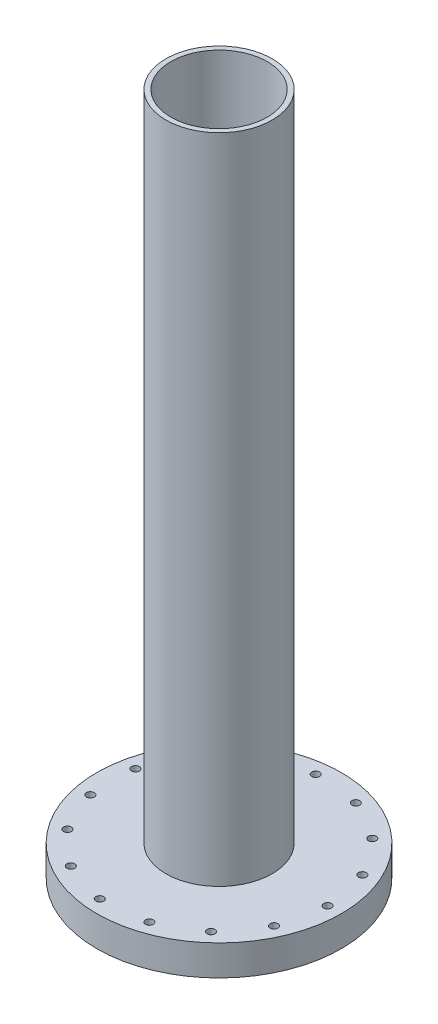
from build123d import *

# Parameters (mm, degrees)
SKETCH1_R                        = 35
SKETCH1_R_2                      = 31.75
BOSS_EXTRUDE1_DEPTH              = 450
SKETCH2_R                        = 80.54
SKETCH2_R_2                      = 31.75
BOSS_EXTRUDE2_DEPTH              = 20
F_13_64_0_20313_DIAMETER_HOLE1_D = 5.159502
CIRPATTERN1_COUNT                = 15


with BuildPart() as part:
    # Sketch1 → Boss-Extrude1 (new body)
    with BuildSketch(Plane(origin=(0, 0, 0), x_dir=(1, 0, 0), z_dir=(0, 1, 0))):
        Circle(SKETCH1_R)
        Circle(SKETCH1_R_2, mode=Mode.SUBTRACT)
    extrude(amount=BOSS_EXTRUDE1_DEPTH)

    # Sketch2 → Boss-Extrude2 (add)
    with BuildSketch(Plane(origin=(0, 0, 0), x_dir=(1, 0, 0), z_dir=(0, 1, 0))):
        Circle(SKETCH2_R)
        Circle(SKETCH2_R_2, mode=Mode.SUBTRACT)
    extrude(amount=BOSS_EXTRUDE2_DEPTH)

    # 13/64 (0.20313) Diameter Hole1 (through all)
    with Locations(Plane(origin=(0, 0, 0), x_dir=(-1, 0, 0), z_dir=(0, -1, 0))):
        with Locations((-71.5, 0)):
            f_13_64_0_20313_diameter_hole1 = Hole(F_13_64_0_20313_DIAMETER_HOLE1_D / 2)

    # CirPattern1: 13/64 (0.20313) Diameter Hole1 ×15 about axis
    cirpattern1_axis = Axis((0, 472.5, 0), (0, -1, 0))
    for i in range(1, CIRPATTERN1_COUNT):
        add(f_13_64_0_20313_diameter_hole1.rotate(cirpattern1_axis, i * 360 / CIRPATTERN1_COUNT), mode=Mode.SUBTRACT)


solid = part.part
